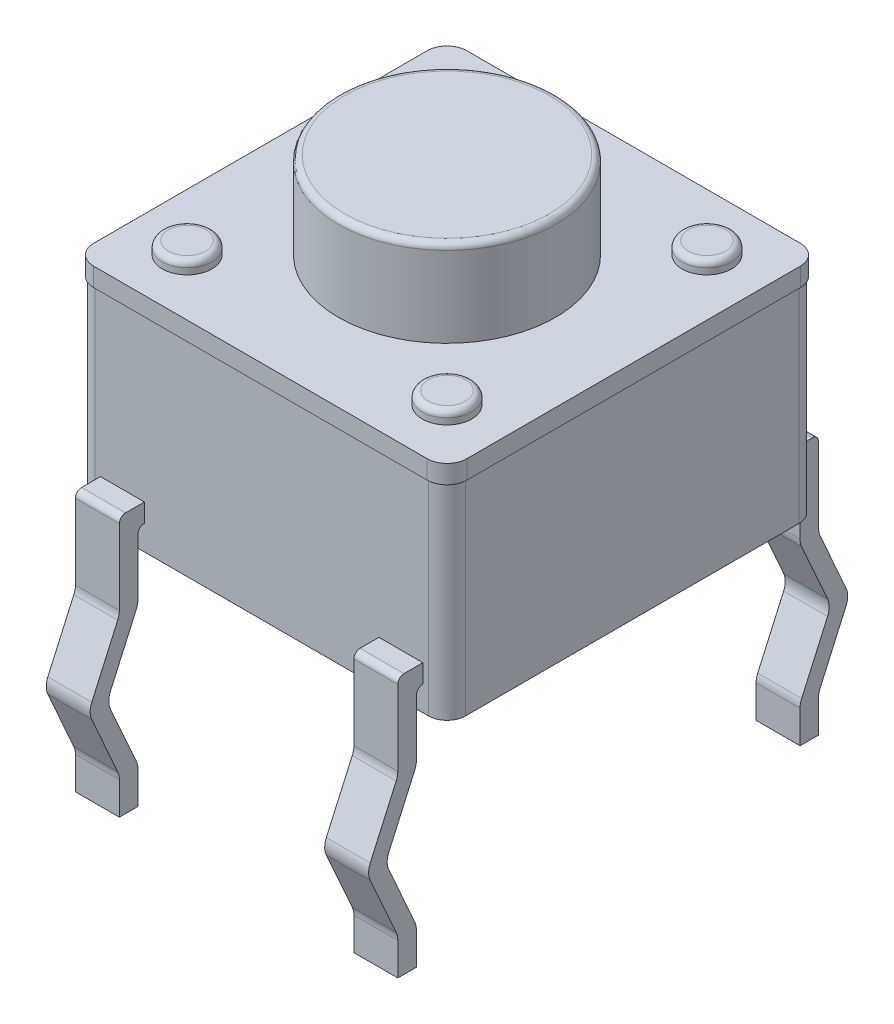
from build123d import *

# Parameters (mm, degrees)
RESSALTO_EXTRUS_O1_DEPTH = 3.61
ESBO_O2_R                = 1.755
RESSALTO_EXTRUS_O2_DEPTH = 1.4
FILETE1_R                = 0.1
ESBO_O3_R                = 0.4
RESSALTO_EXTRUS_O3_DEPTH = 0.2
FILETE2_R                = 0.1
RESSALTO_EXTRUS_O4_DEPTH = 0.3
RESSALTO_EXTRUS_O5_DEPTH = 0.355
ESPELHAR2_COPY_1_DEPTH   = 0.355


with BuildPart() as part:
    # Esboço1 → Ressalto-extrusão1 (new body)
    with BuildSketch(Plane(origin=(0, 0, 0), x_dir=(1, 0, 0), z_dir=(0, 1, 0))):
        with BuildLine():
            Line((-2.695, 2.995), (2.695, 2.995))
            ThreePointArc((2.695, 2.995), (2.907132034, 2.907132034), (2.995, 2.695))
            Line((2.995, 2.695), (2.995, -2.695))
            ThreePointArc((2.995, -2.695), (2.907132034, -2.907132034), (2.695, -2.995))
            Line((2.695, -2.995), (-2.695, -2.995))
            ThreePointArc((-2.695, -2.995), (-2.907132034, -2.907132034), (-2.995, -2.695))
            Line((-2.995, -2.695), (-2.995, 2.695))
            ThreePointArc((-2.995, 2.695), (-2.907132034, 2.907132034), (-2.695, 2.995))
        make_face()
    extrude(amount=RESSALTO_EXTRUS_O1_DEPTH)



with BuildPart() as body_2:
    # Esboço2 → Ressalto-extrusão2 (new body)
    with BuildSketch(Plane(origin=(0, 3.61, 0), x_dir=(1, 0, 0), z_dir=(0, 1, 0))):
        Circle(ESBO_O2_R)
    extrude(amount=RESSALTO_EXTRUS_O2_DEPTH)

    # Filete1
    filete1_edges = [body_2.edges().sort_by_distance(p)[0] for p in [
        (-1.755, 5.01, 0),
    ]]
    fillet(filete1_edges, radius=FILETE1_R)


with BuildPart() as part_1:
    add(part.part)

    add(body_2.part)  # Ressalto-extrusão3 merges body 2
    # Esboço3 → Ressalto-extrusão3 (add)
    with BuildSketch(Plane(origin=(0, 3.61, 0), x_dir=(1, 0, 0), z_dir=(0, 1, 0))):
        with Locations((-2.1, 2.1)):
            Circle(ESBO_O3_R)
        with Locations((2.1, 2.1)):
            Circle(ESBO_O3_R)
        with Locations((2.1, -2.1)):
            Circle(ESBO_O3_R)
        with Locations((-2.1, -2.1)):
            Circle(ESBO_O3_R)
    extrude(amount=RESSALTO_EXTRUS_O3_DEPTH)

    # Filete2
    filete2_edges = [part_1.edges().sort_by_distance(p)[0] for p in [
        (1.7, 3.81, -2.1),
        (1.7, 3.81, 2.1),
        (-2.5, 3.81, -2.1),
        (-2.5, 3.81, 2.1),
    ]]
    fillet(filete2_edges, radius=FILETE2_R)

    # Esboço4 → Ressalto-extrusão4 (add)
    with BuildSketch(Plane(origin=(0, 3.61, 0), x_dir=(1, 0, 0), z_dir=(0, 1, 0))):
        with BuildLine():
            Line((-2.695, -3.015), (2.695, -3.015))
            ThreePointArc((2.695, -3.015), (2.92127417, -2.92127417), (3.015, -2.695))
            Line((3.015, -2.695), (3.015, 2.695))
            ThreePointArc((3.015, 2.695), (2.92127417, 2.92127417), (2.695, 3.015))
            Line((2.695, 3.015), (-2.695, 3.015))
            ThreePointArc((-2.695, 3.015), (-2.92127417, 2.92127417), (-3.015, 2.695))
            Line((-3.015, 2.695), (-3.015, -2.695))
            ThreePointArc((-3.015, -2.695), (-2.92127417, -2.92127417), (-2.695, -3.015))
        make_face()
    extrude(amount=-RESSALTO_EXTRUS_O4_DEPTH)

    # Esboço5 → Ressalto-extrusão5 (add, symmetric)
    with BuildSketch(Plane(origin=(2.25, 0, 0), x_dir=(0, 0, -1), z_dir=(1, 0, 0))):
        with BuildLine():
            Line((2.995, 0.4), (3, 0.4))
            ThreePointArc((3, 0.4), (3.070710678, 0.370710678), (3.1, 0.3))
            Line((3.1, 0.3), (3.1, -0.616076091))
            ThreePointArc((3.1, -0.616076091), (3.106586972, -0.67859645), (3.126058635, -0.738371343))
            Line((3.126058635, -0.738371343), (3.545403905, -1.677704748))
            ThreePointArc((3.545403905, -1.677704748), (3.571462541, -1.8), (3.545403905, -1.922295252))
            Line((3.545403905, -1.922295252), (3.126058635, -2.861628657))
            ThreePointArc((3.126058635, -2.861628657), (3.106586972, -2.92140355), (3.1, -2.983923909))
            Line((3.1, -2.983923909), (3.1, -3.51))
            Line((3.1, -3.51), (3.4, -3.51))
            Line((3.4, -3.51), (3.4, -2.983923909))
            ThreePointArc((3.4, -2.983923909), (3.406586972, -2.92140355), (3.426058635, -2.861628657))
            Line((3.426058635, -2.861628657), (3.845403905, -1.922295252))
            ThreePointArc((3.845403905, -1.922295252), (3.871462541, -1.8), (3.845403905, -1.677704748))
            Line((3.845403905, -1.677704748), (3.426058635, -0.738371343))
            ThreePointArc((3.426058635, -0.738371343), (3.406586972, -0.67859645), (3.4, -0.616076091))
            Line((3.4, -0.616076091), (3.4, 0.6))
            ThreePointArc((3.4, 0.6), (3.370710678, 0.670710678), (3.3, 0.7))
            Line((3.3, 0.7), (2.995, 0.7))
            Line((2.995, 0.7), (2.995, 0.4))
        make_face()
    ressalto_extrus_o5 = extrude(amount=RESSALTO_EXTRUS_O5_DEPTH, both=True)

    # Espelhar1: Ressalto-extrusão5 across plane
    add(ressalto_extrus_o5.mirror(Plane(origin=(0, 0, 0), x_dir=(0, 0, 1), z_dir=(1, 0, 0))))

    # Espelhar2: Ressalto-extrusão5 across plane
    add(ressalto_extrus_o5.mirror(Plane.XY))

    # Espelhar2 copy 1 sketch → Espelhar2 copy 1 (add, symmetric)
    with BuildSketch(Plane.ZY.offset(2.25)):
        with BuildLine():
            Line((2.995, 0.4), (3, 0.4))
            ThreePointArc((3, 0.4), (3.070710678, 0.370710678), (3.1, 0.3))
            Line((3.1, 0.3), (3.1, -0.616076091))
            ThreePointArc((3.1, -0.616076091), (3.106586972, -0.67859645), (3.126058635, -0.738371343))
            Line((3.126058635, -0.738371343), (3.545403905, -1.677704748))
            ThreePointArc((3.545403905, -1.677704748), (3.571462541, -1.8), (3.545403905, -1.922295252))
            Line((3.545403905, -1.922295252), (3.126058635, -2.861628657))
            ThreePointArc((3.126058635, -2.861628657), (3.106586972, -2.92140355), (3.1, -2.983923909))
            Line((3.1, -2.983923909), (3.1, -3.51))
            Line((3.1, -3.51), (3.4, -3.51))
            Line((3.4, -3.51), (3.4, -2.983923909))
            ThreePointArc((3.4, -2.983923909), (3.406586972, -2.92140355), (3.426058635, -2.861628657))
            Line((3.426058635, -2.861628657), (3.845403905, -1.922295252))
            ThreePointArc((3.845403905, -1.922295252), (3.871462541, -1.8), (3.845403905, -1.677704748))
            Line((3.845403905, -1.677704748), (3.426058635, -0.738371343))
            ThreePointArc((3.426058635, -0.738371343), (3.406586972, -0.67859645), (3.4, -0.616076091))
            Line((3.4, -0.616076091), (3.4, 0.6))
            ThreePointArc((3.4, 0.6), (3.370710678, 0.670710678), (3.3, 0.7))
            Line((3.3, 0.7), (2.995, 0.7))
            Line((2.995, 0.7), (2.995, 0.4))
        make_face()
    extrude(amount=ESPELHAR2_COPY_1_DEPTH, both=True)


solid = part_1.part
